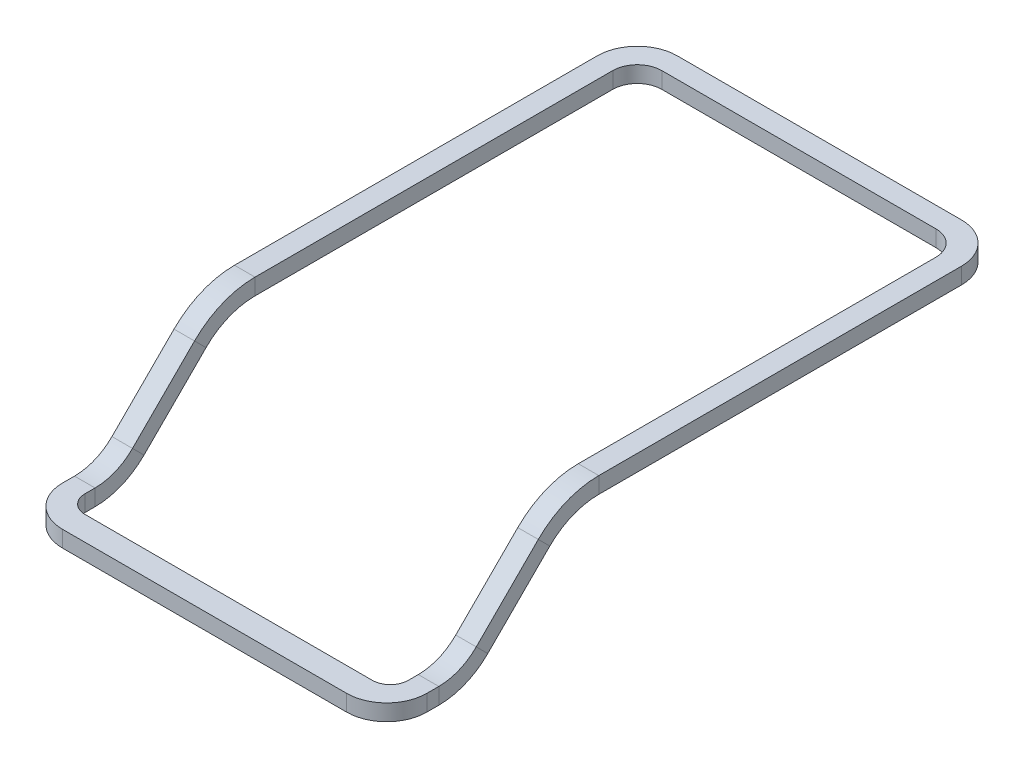
from build123d import *

# Parameters (mm, degrees)
BASE_FLANGE3_DEPTH = 35.5
FILLET1_R          = 7.8
CUT_EXTRUDE1_DEPTH = 128.108455757


# Sheet-metal steps are written as plain solids
with BuildPart() as part:
    # Sketch1 → Base-Flange3 (new, symmetric)
    with BuildSketch(Plane(origin=(0, 0, 0), x_dir=(0, 0, -1), z_dir=(1, 0, 0))):
        with BuildLine():
            Line((0, 0), (10.146233816, 0))
            ThreePointArc((10.146233816, 0), (15.312460153, 1.027626311), (19.692175362, 3.954058454))
            Line((19.692175362, 3.954058454), (31.784058454, 16.045941546))
            ThreePointArc((31.784058454, 16.045941546), (36.163773663, 18.972373689), (41.33, 20))
            Line((41.33, 20), (119.83, 20))
            Line((119.83, 20), (119.83, 23.175))
            Line((119.83, 23.175), (41.33, 23.175))
            ThreePointArc((41.33, 23.175), (34.948753765, 21.905691205), (29.538994424, 18.291005576))
            Line((29.538994424, 18.291005576), (17.447111332, 6.199122484))
            ThreePointArc((17.447111332, 6.199122484), (14.097440255, 3.960943827), (10.146233816, 3.175))
            Line((10.146233816, 3.175), (0, 3.175))
            Line((0, 3.175), (0, 0))
        make_face()
    extrude(amount=BASE_FLANGE3_DEPTH, both=True)

    # Fillet1
    fillet1_edges = [part.edges().sort_by_distance(p)[0] for p in [
        (-35.5, 1.5875, 0),
        (-35.5, 21.5875, -119.83),
        (35.5, 1.5875, 0),
        (35.5, 21.5875, -119.83),
    ]]
    fillet(fillet1_edges, radius=FILLET1_R)

    # Sketch15 → Cut-Extrude1 (cut, through all)
    with BuildSketch(Plane(origin=(0, 23.175, 0), x_dir=(1, 0, 0), z_dir=(0, 1, 0))):
        with BuildLine():
            Line((-26.725, 115.83), (26.725, 115.83))
            ThreePointArc((26.725, 115.83), (30.10143488, 114.43143488), (31.5, 111.055))
            Line((31.5, 111.055), (31.5, 8.2))
            ThreePointArc((31.5, 8.2), (30.474873734, 5.725126266), (28, 4.7))
            Line((28, 4.7), (-28, 4.7))
            ThreePointArc((-28, 4.7), (-30.474873734, 5.725126266), (-31.5, 8.2))
            Line((-31.5, 8.2), (-31.5, 111.055))
            ThreePointArc((-31.5, 111.055), (-30.10143488, 114.43143488), (-26.725, 115.83))
        make_face()
    extrude(amount=-CUT_EXTRUDE1_DEPTH, mode=Mode.SUBTRACT)


solid = part.part
